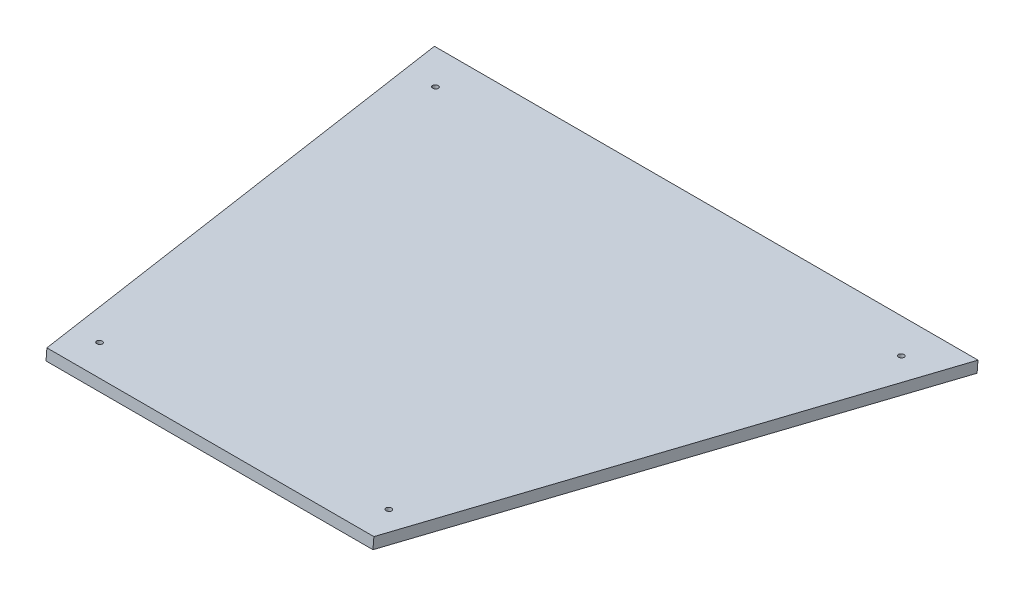
from build123d import *

# Parameters (mm, degrees)
BOSS_EXTRUDE1_DEPTH = 12.7
SKETCH2_R           = 3.175000001
CUT_EXTRUDE1_DEPTH  = 2375.892579794


with BuildPart() as part:
    # Sketch1 → Boss-Extrude1 (new body)
    with BuildSketch(Plane(origin=(-0.000653592, -8154.072715, 672.657736852), x_dir=(-0.9999999999999969, 7.961414168714261e-08, -6.567661367452003e-09), z_dir=(-7.988457756299225e-08, -0.996614682353027, 0.0822142014397072))):
        Polygon((927.932358973, -1893.28840213), (1306.839320092, -1893.28840213), (1432.35206282, -1316.739819062), (802.419616244, -1316.739819062), align=None)
    extrude(amount=BOSS_EXTRUDE1_DEPTH)

    # Sketch2 → Cut-Extrude1 (cut, through all)
    with BuildSketch(Plane(origin=(-0.000653597, -8154.072715, 672.657736852), x_dir=(0.9999999999999968, -7.961414422751635e-08, 6.5676468617910225e-09), z_dir=(7.988457890219468e-08, 0.9966146823530272, -0.08221420143970452))):
        with Locations((-1284.956595837, -1854.019614904)):
            Circle(SKETCH2_R)
        with Locations((-949.797461581, -1853.938669103)):
            Circle(SKETCH2_R)
        with Locations((-1387.301054815, -1360.701208825)):
            Circle(SKETCH2_R)
        with Locations((-847.470624239, -1360.701208825)):
            Circle(SKETCH2_R)
    extrude(amount=-CUT_EXTRUDE1_DEPTH, mode=Mode.SUBTRACT)


solid = part.part
